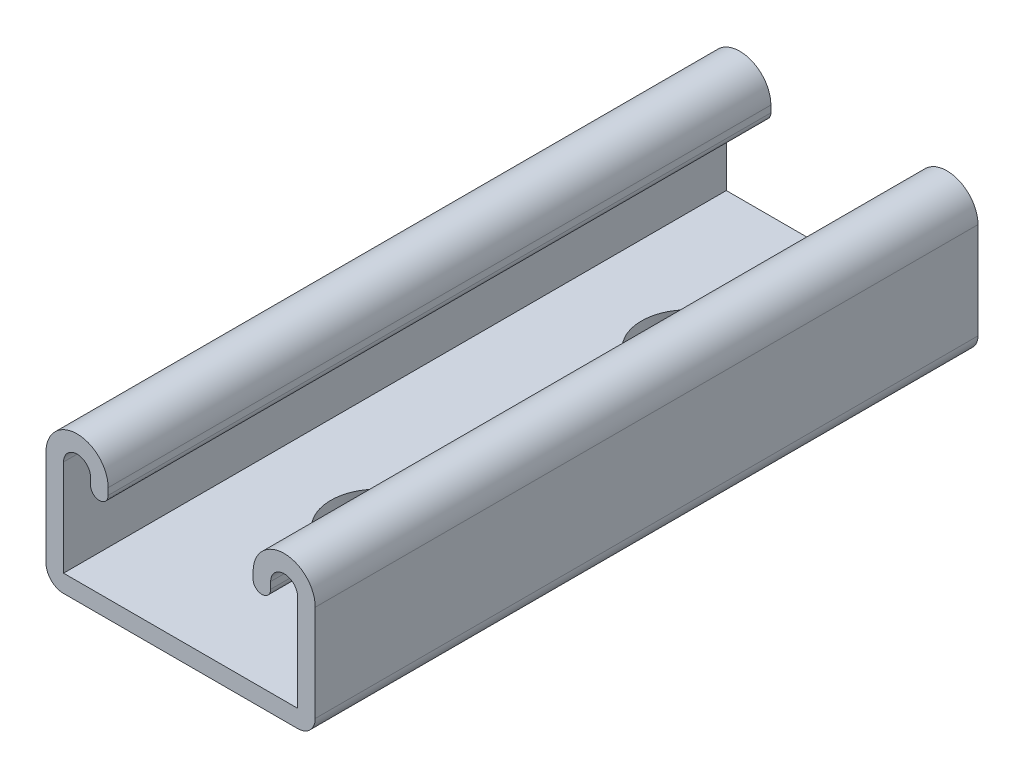
from build123d import *

# Parameters (mm, degrees)
BASE_EXTRUDE_DEPTH = 101.6
HOLE1_START        = -9.0932
HOLE1_OUTLINE_R    = 7.14375
HOLE1_DEPTH        = 2.6924
LPATTERN2_COUNT    = 2
LPATTERN2_PITCH    = 47.625


# Read off the part's stored shape, not the designer's step: Hole1
with BuildPart() as part:
    # Sketch1 → Base-Extrude (new body)
    with BuildSketch(Plane.XY):
        with BuildLine():
            Line((-20.6375, 8.3693), (-20.6375, -6.4008))
            ThreePointArc((-20.6375, -6.4008), (-19.848914298, -8.304614298), (-17.9451, -9.0932))
            Line((-17.9451, -9.0932), (17.9451, -9.0932))
            ThreePointArc((17.9451, -9.0932), (19.848914298, -8.304614298), (20.6375, -6.4008))
            Line((20.6375, -6.4008), (20.6375, 8.3693))
            ThreePointArc((20.6375, 8.3693), (15.875, 13.1318), (11.1125, 8.3693))
            Line((11.1125, 8.3693), (11.1125, 7.33425))
            ThreePointArc((11.1125, 7.33425), (12.4587, 5.98805), (13.8049, 7.33425))
            Line((13.8049, 7.33425), (13.8049, 8.3693))
            ThreePointArc((13.8049, 8.3693), (15.875, 10.4394), (17.9451, 8.3693))
            Line((17.9451, 8.3693), (17.9451, -6.4008))
            Line((17.9451, -6.4008), (-17.9451, -6.4008))
            Line((-17.9451, -6.4008), (-17.9451, 8.3693))
            ThreePointArc((-17.9451, 8.3693), (-15.875, 10.4394), (-13.8049, 8.3693))
            Line((-13.8049, 8.3693), (-13.8049, 7.33425))
            ThreePointArc((-13.8049, 7.33425), (-12.4587, 5.98805), (-11.1125, 7.33425))
            Line((-11.1125, 7.33425), (-11.1125, 8.3693))
            ThreePointArc((-11.1125, 8.3693), (-15.875, 13.1318), (-20.6375, 8.3693))
        make_face()
    extrude(amount=BASE_EXTRUDE_DEPTH)

    # Hole1 outline → Hole1 (cut)
    with BuildSketch(Plane(origin=(0, 0, 0), x_dir=(1, 0, 0), z_dir=(0, 1, 0)).offset(HOLE1_START)):
        with Locations((0, -23.8125)):
            Circle(HOLE1_OUTLINE_R)
    hole1 = extrude(amount=HOLE1_DEPTH, mode=Mode.SUBTRACT)

    # LPattern2: Hole1 ×2
    with Locations(*[(0, 0, i * LPATTERN2_PITCH) for i in range(1, LPATTERN2_COUNT)]):
        add(hole1, mode=Mode.SUBTRACT)


solid = part.part
